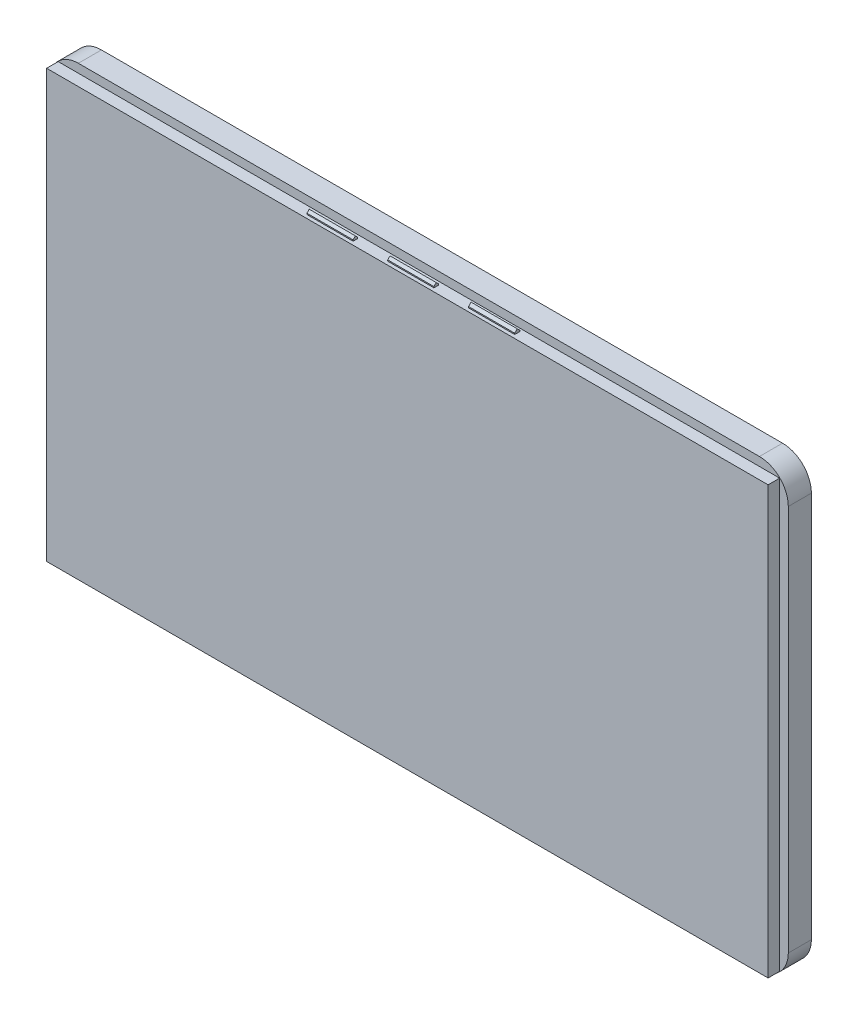
from build123d import *

# Parameters (mm, degrees)
SKETCH1_W                = 64
SKETCH1_H                = 38.5
BOSS_EXTRUDE1_DEPTH      = 3
SKETCH2_W                = 64
SKETCH2_H                = 38.5
SKETCH2_W_2              = 62.5
SKETCH2_H_2              = 37
CUT_EXTRUDE1_DEPTH       = 1
BOSS_EXTRUDE2_DEPTH      = 0.5
BOSS_EXTRUDE2_DEPTH_BACK = 37.5
SKETCH3_W                = 4
SKETCH3_H                = 0.4
SKETCH3_H_2              = 0.44075926
CHAMFER8_SIZE            = 0.4
CHAMFER9_SIZE            = 0.4
CHAMFER10_SIZE           = 0.4
CHAMFER11_SIZE           = 0.4
FILLET7_R                = 2.5


with BuildPart() as part:
    # Sketch1 → Boss-Extrude1 (new body)
    with BuildSketch(Plane.XY):
        with Locations((32, 19.25)):
            Rectangle(SKETCH1_W, SKETCH1_H)
    extrude(amount=BOSS_EXTRUDE1_DEPTH)

    # Sketch2 → Cut-Extrude1 (cut)
    with BuildSketch(Plane.XY.offset(3)):
        with Locations((32, 19.25)):
            Rectangle(SKETCH2_W, SKETCH2_H)
        with Locations((32, 19.25)):
            Rectangle(SKETCH2_W_2, SKETCH2_H_2, mode=Mode.SUBTRACT)
    extrude(amount=-CUT_EXTRUDE1_DEPTH, mode=Mode.SUBTRACT)

    # Sketch3 → Boss-Extrude2 (add, two sides: drawn at the far end of the back side and taken through both)
    with BuildSketch(Plane.XZ.offset(-0.75).offset(-BOSS_EXTRUDE2_DEPTH_BACK)):
        with Locations((32, 2.5)):
            Rectangle(SKETCH3_W, SKETCH3_H)
        with Locations((39, 2.47962037)):
            Rectangle(SKETCH3_W, SKETCH3_H_2)
        with Locations((25, 2.5)):
            Rectangle(SKETCH3_W, SKETCH3_H)
    extrude(amount=BOSS_EXTRUDE2_DEPTH + BOSS_EXTRUDE2_DEPTH_BACK)

    # Chamfer8
    # the kernel refuses this chamfer: 0.4 mm, written as the material it takes off along each edge
    with BuildSketch(Plane(origin=(42.028673195, 0.25, 2.25924074), x_dir=(0, 0.9996219169112968, -0.02749587661058628), z_dir=(-1, 0, 0)), Plane(origin=(35.971326805, 0.25, 2.7), x_dir=(0, 0.9996219169112968, 0.02749587661058628), z_dir=(1, 0, 0))) as chamfer8_piece_1:
        Polygon((CHAMFER8_SIZE * 0.999621916911, -CHAMFER8_SIZE * 0.0274958766106), (-CHAMFER8_SIZE * 0.0274958766106, -CHAMFER8_SIZE * 0.999621916911), (0, 0), align=None)
    extrude(amount=6.05734639, mode=Mode.SUBTRACT)

    # Chamfer9
    # the kernel refuses this chamfer: 0.4 mm, written as the material it takes off along each edge
    with BuildSketch(Plane(origin=(35.028673195, 0.25, 2.3), x_dir=(0, 0.9996219169112968, -0.02749587661058628), z_dir=(-1, 0, 0)), Plane(origin=(28.971326805, 0.25, 2.7), x_dir=(0, 0.9996219169112968, 0.02749587661058628), z_dir=(1, 0, 0))) as chamfer9_piece_1:
        Polygon((CHAMFER9_SIZE * 0.999621916911, -CHAMFER9_SIZE * 0.0274958766106), (-CHAMFER9_SIZE * 0.0274958766106, -CHAMFER9_SIZE * 0.999621916911), (0, 0), align=None)
    extrude(amount=6.05734639, mode=Mode.SUBTRACT)

    # Chamfer10
    # the kernel refuses this chamfer: 0.4 mm, written as the material it takes off along each edge
    with BuildSketch(Plane(origin=(21.971326805, 0.25, 2.3), x_dir=(0, 0.9996219169112968, -0.02749587661058628), z_dir=(1, 0, 0)), Plane(origin=(28.028673195, 0.25, 2.7), x_dir=(0, 0.9996219169112968, 0.02749587661058628), z_dir=(-1, 0, 0))) as chamfer10_piece_1:
        Polygon((CHAMFER10_SIZE * 0.999621916911, CHAMFER10_SIZE * 0.0274958766106), (-CHAMFER10_SIZE * 0.0274958766106, CHAMFER10_SIZE * 0.999621916911), (0, 0), align=None)
    extrude(amount=6.05734639, mode=Mode.SUBTRACT)

    # Chamfer11
    # the kernel refuses this chamfer: 0.4 mm, written as the material it takes off along each edge
    with BuildSketch(Plane(origin=(42.028673195, 38.25, 2.25924074), x_dir=(0, -0.9996219169112968, -0.02749587661058658), z_dir=(-1, 0, 0)), Plane(origin=(35.971326805, 38.25, 2.7), x_dir=(0, -0.9996219169112968, 0.02749587661058658), z_dir=(1, 0, 0)), Plane(origin=(35.028673195, 38.25, 2.3), x_dir=(0, -0.9996219169112968, -0.02749587661058658), z_dir=(-1, 0, 0)), Plane(origin=(28.971326805, 38.25, 2.7), x_dir=(0, -0.9996219169112968, 0.02749587661058658), z_dir=(1, 0, 0))) as chamfer11_piece_1:
        Polygon((CHAMFER11_SIZE * 0.999621916911, CHAMFER11_SIZE * 0.0274958766106), (-CHAMFER11_SIZE * 0.0274958766106, CHAMFER11_SIZE * 0.999621916911), (0, 0), align=None)
    extrude(amount=6.05734639, mode=Mode.SUBTRACT)
    with BuildSketch(Plane(origin=(21.971326805, 38.25, 2.3), x_dir=(0, -0.9996219169112968, -0.02749587661058658), z_dir=(1, 0, 0)), Plane(origin=(28.028673195, 38.25, 2.7), x_dir=(0, -0.9996219169112968, 0.02749587661058658), z_dir=(-1, 0, 0))) as chamfer11_piece_2:
        Polygon((CHAMFER11_SIZE * 0.999621916911, -CHAMFER11_SIZE * 0.0274958766106), (-CHAMFER11_SIZE * 0.0274958766106, -CHAMFER11_SIZE * 0.999621916911), (0, 0), align=None)
    extrude(amount=6.05734639, mode=Mode.SUBTRACT)

    # Fillet7
    fillet7_edges = [part.edges().sort_by_distance(p)[0] for p in [
        (0, 38.5, 1),
        (64, 38.5, 1),
        (64, 0, 1),
        (0, 0, 1),
    ]]
    fillet(fillet7_edges, radius=FILLET7_R)


solid = part.part
